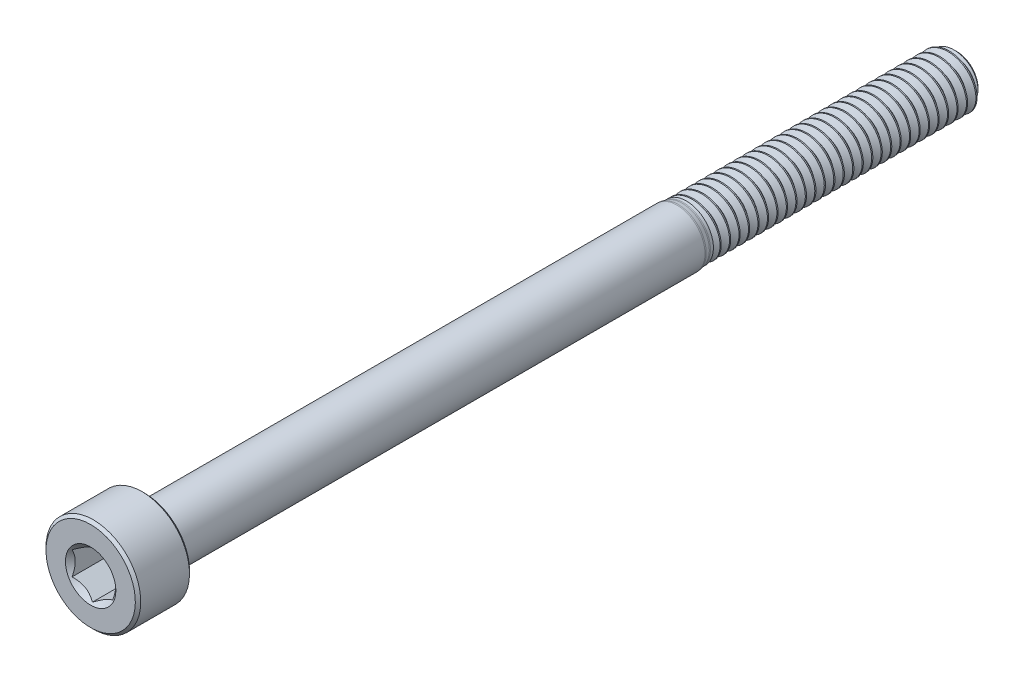
from build123d import *

# Parameters (mm, degrees)
CUT_EXTRUDE1_DEPTH     = 3
SPLIT1_SURFACE_1_BACK  = 65.761
SPLIT1_SURFACE_1_DEPTH = 131.522
SPLIT1_SURFACE_2_BACK  = 65.761
SPLIT1_SURFACE_2_DEPTH = 131.522
CUT_SWEEP1_PITCH       = 0.7
CUT_SWEEP1_TO          = 20


with BuildPart() as part:
    # Sketch2 → Revolve1 (revolve)
    with BuildSketch(Plane(origin=(0, 0, 0), x_dir=(0, 0, -1), z_dir=(1, 0, 0))):
        with BuildLine():
            Line((-32, 0), (-32, 3.3))
            Line((-32, 3.3), (-31.8, 3.5))
            Line((-31.8, 3.5), (-28.2, 3.5))
            Line((-28.2, 3.5), (-28, 3.3))
            Line((-28, 3.3), (-28, 2.275777223))
            ThreePointArc((-28, 2.275777223), (-27.941421356, 2.134355867), (-27.8, 2.075777223))
            Line((-27.8, 2.075777223), (11.307296473, 2.075777223))
            ThreePointArc((11.307296473, 2.075777223), (11.356305044, 2.073369586), (11.404841634, 2.066169863))
            Line((11.404841634, 2.066169863), (11.689200541, 2.00960736))
            ThreePointArc((11.689200541, 2.00960736), (11.737737132, 2.002407637), (11.786745702, 2))
            Line((11.786745702, 2), (31.545336663, 2))
            Line((31.545336663, 2), (32, 1.545336663))
            Line((32, 1.545336663), (32, 0))
            Line((32, 0), (-32, 0))
        make_face()
    revolve(axis=Axis((0, 0, -32), (0, 0, 1)))

    # Sketch3 → Cut-Extrude1 (cut)
    with BuildSketch(Plane.XY.offset(32)):
        Polygon((1.5, -0.866025404), (1.5, 0.866025404), (0, 1.732050808), (-1.5, 0.866025404), (-1.5, -0.866025404), (0, -1.732050808), align=None)
    extrude(amount=-CUT_EXTRUDE1_DEPTH, mode=Mode.SUBTRACT)

    # Cut-Extrude2 cone 1 section (through the dimple's axis) → Cut-Extrude2 (revolve, cut)
    with BuildSketch(Plane(origin=(0, 0, 32), x_dir=(0, -1, 0), z_dir=(1, 0, 0))):
        Polygon((0, 0), (1.861954618, 0), (0, 1.861954618), align=None)
    revolve(axis=Axis((0, 0, 32), (0, 0, -1)), mode=Mode.SUBTRACT)


with BuildPart() as body_2:
    # Split1: the piece behind the surface
    add(part.part)
    # Split1 surface: a surface, the sketch's curves swept straight by 131.522 mm
    with BuildLine(Plane(origin=(0, 0, 0), x_dir=(0, 0, -1), z_dir=(1, 0, 0)).offset(-SPLIT1_SURFACE_1_BACK), mode=Mode.PRIVATE) as split1_surface_1_path:
        Line((12, -2), (12, 2))
    split1_surface_1 = Shell.extrude(split1_surface_1_path.wire(), (1 * SPLIT1_SURFACE_1_DEPTH, 0 * SPLIT1_SURFACE_1_DEPTH, 0 * SPLIT1_SURFACE_1_DEPTH))
    split(bisect_by=split1_surface_1, keep=Keep.BOTTOM)

    # Cut-Sweep1: arcs per turn and ends read off the stored shape
    # Cut-Sweep1: the profile of Sketch7 screwed along a right-hand helix through 29.571429 turns, 6 arcs to a turn; built about Z, then put on its axis
    cut_sweep1_z = Axis((0, 0, 0), (0, 0, 1))
    cut_sweep1_corners = [(2.037888611, 0, 0.021875), (2.037888611, 0, -0.634375), (1.545336663, 0, -0.35), (1.545336663, 0, -0.2625)]
    with BuildLine(mode=Mode.PRIVATE) as cut_sweep1_profile:
        Line(cut_sweep1_corners[0], cut_sweep1_corners[1])
        Line(cut_sweep1_corners[1], cut_sweep1_corners[2])
        Line(cut_sweep1_corners[2], cut_sweep1_corners[3])
        Line(cut_sweep1_corners[3], cut_sweep1_corners[0])
    cut_sweep1_cap = Face(cut_sweep1_profile.wire())
    cut_sweep1_turn_angles = [0, 30, 60, 90, 120, 150, 180, 210, 240, 270, 300, 330, 360]
    cut_sweep1_turn_weights = [1, 0.8660254037844387, 1, 0.8660254037844387, 1, 0.8660254037844387, 1, 0.8660254037844387, 1, 0.8660254037844387, 1, 0.8660254037844387, 1]
    cut_sweep1_turn_rails = [Edge.make_bspline([Vector(p[0], p[1], 0).rotate(cut_sweep1_z, cut_sweep1_turn_angles[k]) / cut_sweep1_turn_weights[k] + Vector(0, 0, p[2] + CUT_SWEEP1_PITCH * cut_sweep1_turn_angles[k] / 360) for k in range(13)], [0, 0, 0, 1, 1, 2, 2, 3, 3, 4, 4, 5, 5, 6, 6, 6], 2, cut_sweep1_turn_weights) for p in cut_sweep1_corners]
    cut_sweep1_turn_sides = [Face.make_surface_from_curves(cut_sweep1_turn_rails[p[0]], cut_sweep1_turn_rails[p[1]]) for p in [(0, 1), (1, 2), (2, 3), (3, 0)]]
    cut_sweep1_last_angles = [10440, 10470, 10500, 10530, 10560, 10590, 10620, 10632.857142857, 10645.714285714]
    cut_sweep1_last_weights = [1, 0.8660254037844387, 1, 0.8660254037844387, 1, 0.8660254037844387, 1, 0.9749279121817342, 1]
    cut_sweep1_last_rails = [Edge.make_bspline([Vector(p[0], p[1], 0).rotate(cut_sweep1_z, cut_sweep1_last_angles[k]) / cut_sweep1_last_weights[k] + Vector(0, 0, p[2] + CUT_SWEEP1_PITCH * cut_sweep1_last_angles[k] / 360) for k in range(9)], [0, 0, 0, 1, 1, 2, 2, 3, 3, 4, 4, 4], 2, cut_sweep1_last_weights) for p in cut_sweep1_corners]
    cut_sweep1_last_sides = [Face.make_surface_from_curves(cut_sweep1_last_rails[p[0]], cut_sweep1_last_rails[p[1]]) for p in [(0, 1), (1, 2), (2, 3), (3, 0)]]
    cut_sweep1 = Plane(origin=(0, 0, -32), x_dir=(0, 1, 0), z_dir=(0, 0, 1)) * split(Solid(Shell([*[p.moved(Location((0, 0, CUT_SWEEP1_PITCH * i))) for i in range(29) for p in cut_sweep1_turn_sides], *cut_sweep1_last_sides, cut_sweep1_cap, cut_sweep1_cap.rotate(cut_sweep1_z, 10645.714285714).moved(Location((0, 0, CUT_SWEEP1_PITCH * 10645.714285714 / 360)))])), bisect_by=Plane.XY.offset(CUT_SWEEP1_TO), keep=Keep.BOTTOM, mode=Mode.PRIVATE)
    add(cut_sweep1, mode=Mode.SUBTRACT)


with BuildPart() as part_1:
    add(part.part)

    # Split1: split by a surface, the side it looks to stays
    # Split1 surface: a surface, the sketch's curves swept straight by 131.522 mm
    with BuildLine(Plane(origin=(0, 0, 0), x_dir=(0, 0, -1), z_dir=(1, 0, 0)).offset(-SPLIT1_SURFACE_2_BACK), mode=Mode.PRIVATE) as split1_surface_2_path:
        Line((12, -2), (12, 2))
    split1_surface_2 = Shell.extrude(split1_surface_2_path.wire(), (1 * SPLIT1_SURFACE_2_DEPTH, 0 * SPLIT1_SURFACE_2_DEPTH, 0 * SPLIT1_SURFACE_2_DEPTH))
    split(bisect_by=split1_surface_2, keep=Keep.TOP)

    add(body_2.part)  # Revolve2 merges body 2
    # Sketch8 → Revolve2 (revolve)
    with BuildSketch(Plane(origin=(0, 0, 0), x_dir=(0, 0, -1), z_dir=(1, 0, 0))):
        Polygon((-28, 0), (-28, 2), (12, 2), (13.154700538, 0), align=None)
    revolve(axis=Axis((0, 0, -13.154700538), (0, 0, 1)))


solid = part_1.part
